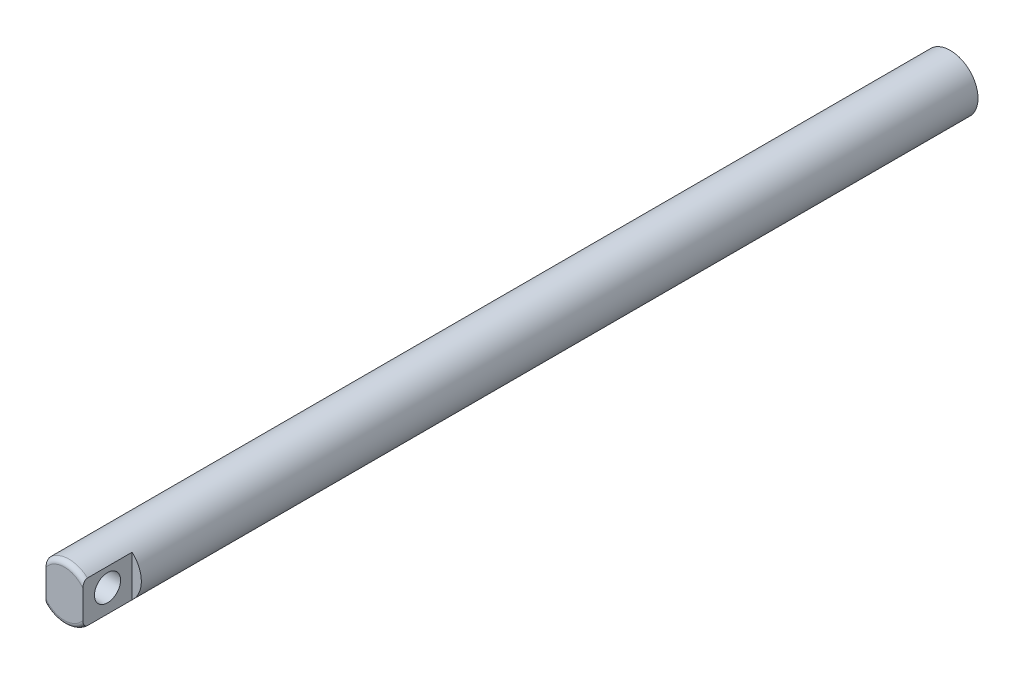
from build123d import *

# Parameters (mm, degrees)
SKETCH1_R               = 4.5
BOSS_EXTRUDE1_DEPTH     = 144
CUT_EXTRUDE1_START      = -3
SKETCH3_W               = 8
SKETCH3_H               = 9
CUT_EXTRUDE1_DEPTH      = 1.5
FILLET1_R               = 0.75
CUT_EXTRUDE2_DEPTH      = 145.265380565
CUT_EXTRUDE2_DEPTH_BACK = 145.265380565
SKETCH4_R               = 2.125


with BuildPart() as part:
    # Sketch1 → Boss-Extrude1 (new body)
    with BuildSketch(Plane.XY):
        Circle(SKETCH1_R)
    extrude(amount=BOSS_EXTRUDE1_DEPTH)

    # Sketch3 → Cut-Extrude1 (cut)
    with BuildSketch(Plane(origin=(0, 0, 0), x_dir=(0, 0, -1), z_dir=(1, 0, 0)).offset(CUT_EXTRUDE1_START)):
        with Locations((-140, 0)):
            Rectangle(SKETCH3_W, SKETCH3_H)
    cut_extrude1 = extrude(amount=-CUT_EXTRUDE1_DEPTH, mode=Mode.SUBTRACT)

    # Mirror1: Cut-Extrude1 across plane
    add(cut_extrude1.mirror(Plane(origin=(0, 0, 0), x_dir=(0, 0, 1), z_dir=(1, 0, 0))), mode=Mode.SUBTRACT)

    # Fillet1
    fillet1_edges = [part.edges().sort_by_distance(p)[0] for p in [
        (0, -4.5, 144),
        (0, 4.5, 144),
    ]]
    fillet(fillet1_edges, radius=FILLET1_R)

    # Sketch4 → Cut-Extrude2 (cut, two sides: drawn at the far end of the back side and taken through both)
    with BuildSketch(Plane(origin=(3, 0, 0), x_dir=(0, 0, -1), z_dir=(1, 0, 0)).offset(-CUT_EXTRUDE2_DEPTH_BACK)):
        with Locations((-140, 0.354101966)):
            Circle(SKETCH4_R)
    extrude(amount=CUT_EXTRUDE2_DEPTH + CUT_EXTRUDE2_DEPTH_BACK, mode=Mode.SUBTRACT)


solid = part.part
